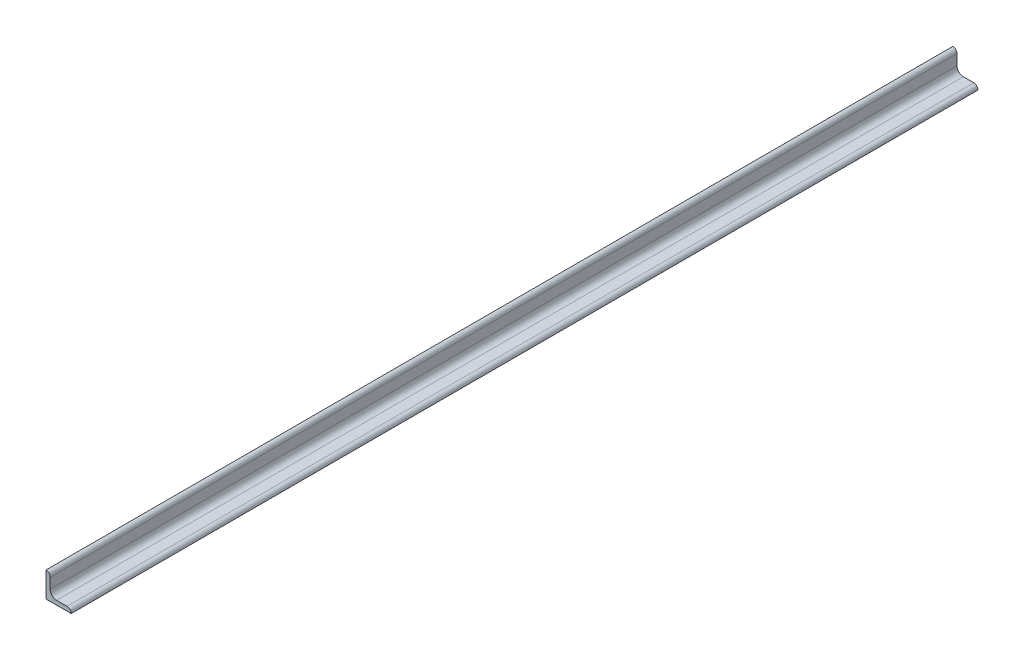
from build123d import *

# Parameters (mm, degrees)
BASESTEELANGLE_DEPTH = 342.9


with BuildPart() as part:
    # Sketch1 → BaseSteelAngle (new, symmetric)
    with BuildSketch(Plane.XY):
        with BuildLine():
            Line((0, 0), (0, 19.05))
            Line((0, 19.05), (0.00508, 19.05))
            ThreePointArc((0.00508, 19.05), (2.246551928, 18.121551928), (3.175, 15.88008))
            Line((3.175, 15.88008), (3.175, 7.9375))
            ThreePointArc((3.175, 7.9375), (4.569903955, 4.569903955), (7.9375, 3.175))
            Line((7.9375, 3.175), (15.88008, 3.175))
            ThreePointArc((15.88008, 3.175), (18.121551928, 2.246551928), (19.05, 0.00508))
            Line((19.05, 0.00508), (19.05, 0))
            Line((19.05, 0), (0, 0))
        make_face()
    extrude(amount=BASESTEELANGLE_DEPTH, both=True)


solid = part.part
